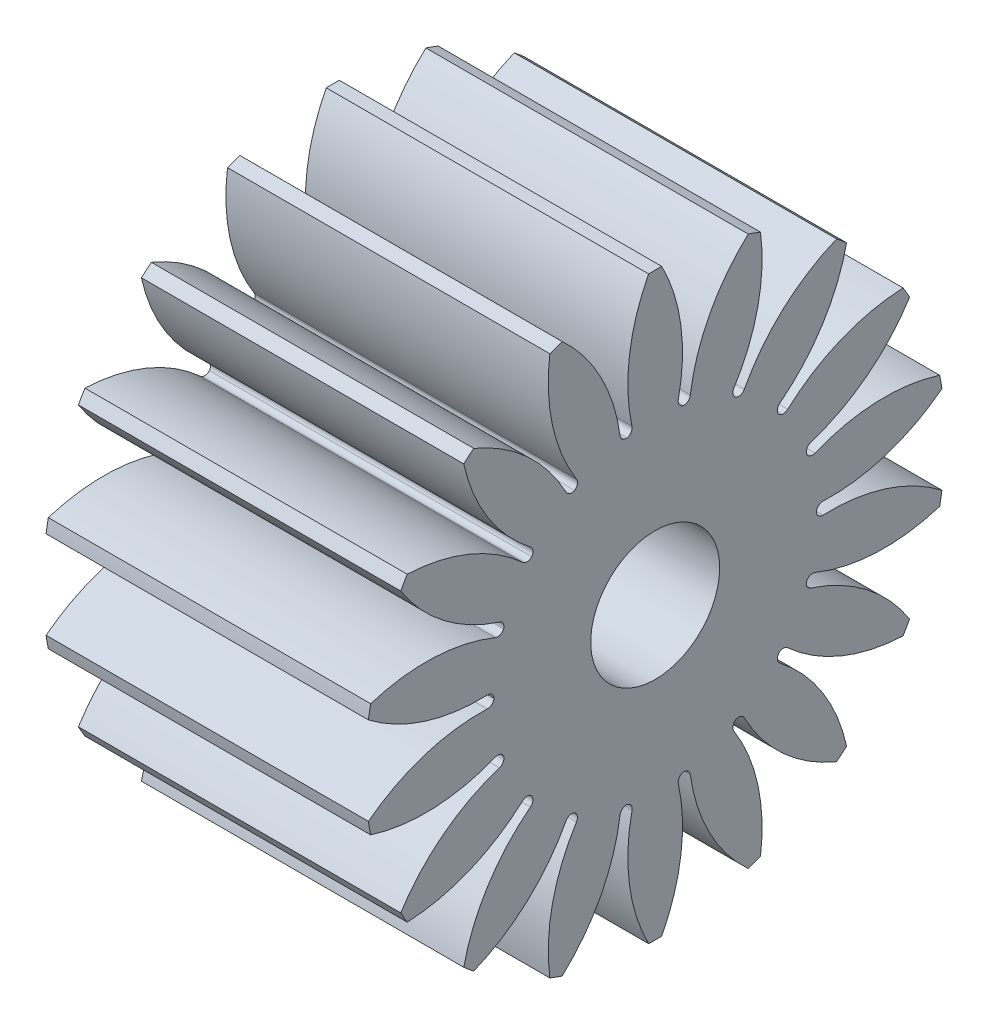
from build123d import *

# Parameters (mm, degrees)
SKETCH1_R               = 45
BOSS_EXTRUDE1_DEPTH     = 50
CUT_EXTRUDE1_DEPTH      = 81.932070281
CUT_EXTRUDE1_DEPTH_BACK = 81.932070281
SKETCH2_OUTSIDE_W       = 119.35
SKETCH2_OUTSIDE_H       = 119.35
FILLET4_R               = 1
FILLET5_R               = 1
CUT_EXTRUDE2_DEPTH      = 81.644696754
CUT_EXTRUDE2_DEPTH_BACK = 81.644696754
SKETCH3_R               = 10


with BuildPart() as part:
    # Sketch1 → Boss-Extrude1 (new body)
    with BuildSketch(Plane.YZ):
        with Locations(Location((0, 0, 0), (0, 0, 270))):
            Circle(SKETCH1_R)
    extrude(amount=BOSS_EXTRUDE1_DEPTH)

    # Sketch2 outside → Cut-Extrude1 (cut, two sides: drawn at the far end of the back side and taken through both)
    with BuildSketch(Plane.YZ.offset(50).offset(-CUT_EXTRUDE1_DEPTH_BACK)):
        Rectangle(SKETCH2_OUTSIDE_W, SKETCH2_OUTSIDE_H)
        with BuildLine():
            ThreePointArc((8.810204422, 44.129132079), (7.814167995, 44.316348886), (6.814167995, 44.481087156))
            ThreePointArc((6.814167995, 44.481087156), (2.105399573, 35.267704069), (1, 24.979991994))
            ThreePointArc((1, 24.979991994), (0, 25), (-1, 24.979991994))
            ThreePointArc((-1, 24.979991994), (-2.105399573, 35.267704069), (-6.814167995, 44.481087156))
            ThreePointArc((-6.814167995, 44.481087156), (-7.814167995, 44.316348886), (-8.810204422, 44.129132079))
            ThreePointArc((-8.810204422, 44.129132079), (-10.083836757, 33.860890329), (-7.603967821, 23.815534287))
            ThreePointArc((-7.603967821, 23.815534287), (-8.550503583, 23.49231552), (-9.483353063, 23.131494))
            ThreePointArc((-9.483353063, 23.131494), (-14.040693643, 32.420712202), (-21.616651186, 39.46796665))
            ThreePointArc((-21.616651186, 39.46796665), (-22.5, 38.97114317), (-23.371936162, 38.454552397))
            ThreePointArc((-23.371936162, 38.454552397), (-21.056813554, 28.369953482), (-15.2907849, 19.778571666))
            ThreePointArc((-15.2907849, 19.778571666), (-16.069690242, 19.151111078), (-16.822873787, 18.492996446))
            ThreePointArc((-16.822873787, 18.492996446), (-24.282472841, 25.663303964), (-33.811847216, 29.694426882))
            ThreePointArc((-33.811847216, 29.694426882), (-34.47199994, 28.925442436), (-35.114667467, 28.141786167))
            ThreePointArc((-35.114667467, 28.141786167), (-29.49002787, 19.45718155), (-21.133307653, 13.356021401))
            ThreePointArc((-21.133307653, 13.356021401), (-21.650635095, 12.5), (-22.133307653, 11.623970593))
            ThreePointArc((-22.133307653, 11.623970593), (-31.595427443, 15.810522519), (-41.928835462, 16.339300988))
            ThreePointArc((-41.928835462, 16.339300988), (-42.286167935, 15.39090645), (-42.622051639, 14.434705197))
            ThreePointArc((-42.622051639, 14.434705197), (-34.366309599, 8.197586365), (-24.426841608, 5.322537841))
            ThreePointArc((-24.426841608, 5.322537841), (-24.620193825, 4.341204442), (-24.774137963, 3.352922335))
            ThreePointArc((-24.774137963, 3.352922335), (-35.097507197, 4.050758719), (-44.988587348, 1.013414253))
            ThreePointArc((-44.988587348, 1.013414253), (-45, 0), (-44.988587348, -1.013414253))
            ThreePointArc((-44.988587348, -1.013414253), (-35.097507197, -4.050758719), (-24.774137963, -3.352922335))
            ThreePointArc((-24.774137963, -3.352922335), (-24.620193825, -4.341204442), (-24.426841608, -5.322537841))
            ThreePointArc((-24.426841608, -5.322537841), (-34.366309599, -8.197586365), (-42.622051639, -14.434705197))
            ThreePointArc((-42.622051639, -14.434705197), (-42.286167935, -15.39090645), (-41.928835462, -16.339300988))
            ThreePointArc((-41.928835462, -16.339300988), (-31.595427443, -15.810522519), (-22.133307653, -11.623970593))
            ThreePointArc((-22.133307653, -11.623970593), (-21.650635095, -12.5), (-21.133307653, -13.356021401))
            ThreePointArc((-21.133307653, -13.356021401), (-29.49002787, -19.45718155), (-35.114667467, -28.141786167))
            ThreePointArc((-35.114667467, -28.141786167), (-34.47199994, -28.925442436), (-33.811847216, -29.694426882))
            ThreePointArc((-33.811847216, -29.694426882), (-24.282472841, -25.663303964), (-16.822873787, -18.492996446))
            ThreePointArc((-16.822873787, -18.492996446), (-16.069690242, -19.151111078), (-15.2907849, -19.778571666))
            ThreePointArc((-15.2907849, -19.778571666), (-21.056813554, -28.369953482), (-23.371936162, -38.454552397))
            ThreePointArc((-23.371936162, -38.454552397), (-22.5, -38.97114317), (-21.616651186, -39.46796665))
            ThreePointArc((-21.616651186, -39.46796665), (-14.040693643, -32.420712202), (-9.483353063, -23.131494))
            ThreePointArc((-9.483353063, -23.131494), (-8.550503583, -23.49231552), (-7.603967821, -23.815534287))
            ThreePointArc((-7.603967821, -23.815534287), (-10.083836757, -33.860890329), (-8.810204423, -44.129132079))
            ThreePointArc((-8.810204423, -44.129132079), (-7.814167995, -44.316348886), (-6.814167995, -44.481087156))
            ThreePointArc((-6.814167995, -44.481087156), (-2.105399573, -35.267704069), (-1, -24.979991994))
            ThreePointArc((-1, -24.979991994), (0, -25), (1, -24.979991994))
            ThreePointArc((1, -24.979991994), (2.105399573, -35.267704069), (6.814167995, -44.481087156))
            ThreePointArc((6.814167995, -44.481087156), (7.814167995, -44.316348886), (8.810204422, -44.129132079))
            ThreePointArc((8.810204422, -44.129132079), (10.083836757, -33.860890329), (7.603967821, -23.815534287))
            ThreePointArc((7.603967821, -23.815534287), (8.550503583, -23.49231552), (9.483353063, -23.131494))
            ThreePointArc((9.483353063, -23.131494), (14.040693643, -32.420712202), (21.616651186, -39.46796665))
            ThreePointArc((21.616651186, -39.46796665), (22.5, -38.97114317), (23.371936162, -38.454552397))
            ThreePointArc((23.371936162, -38.454552397), (21.056813554, -28.369953482), (15.2907849, -19.778571666))
            ThreePointArc((15.2907849, -19.778571666), (16.069690242, -19.151111078), (16.822873787, -18.492996446))
            ThreePointArc((16.822873787, -18.492996446), (24.282472841, -25.663303964), (33.811847216, -29.694426882))
            ThreePointArc((33.811847216, -29.694426882), (34.47199994, -28.925442436), (35.114667467, -28.141786167))
            ThreePointArc((35.114667467, -28.141786167), (29.49002787, -19.45718155), (21.133307653, -13.356021401))
            ThreePointArc((21.133307653, -13.356021401), (21.650635095, -12.5), (22.133307653, -11.623970593))
            ThreePointArc((22.133307653, -11.623970593), (31.595427443, -15.810522519), (41.928835462, -16.339300988))
            ThreePointArc((41.928835462, -16.339300988), (42.286167935, -15.39090645), (42.622051639, -14.434705197))
            ThreePointArc((42.622051639, -14.434705197), (34.366309599, -8.197586365), (24.426841608, -5.322537841))
            ThreePointArc((24.426841608, -5.322537841), (24.620193825, -4.341204442), (24.774137963, -3.352922335))
            ThreePointArc((24.774137963, -3.352922335), (35.097507197, -4.050758719), (44.988587348, -1.013414253))
            ThreePointArc((44.988587348, -1.013414253), (45, 0), (44.988587348, 1.013414253))
            ThreePointArc((44.988587348, 1.013414253), (35.097507197, 4.050758719), (24.774137963, 3.352922335))
            ThreePointArc((24.774137963, 3.352922335), (24.620193825, 4.341204442), (24.426841608, 5.322537841))
            ThreePointArc((24.426841608, 5.322537841), (34.366309599, 8.197586365), (42.622051639, 14.434705197))
            ThreePointArc((42.622051639, 14.434705197), (42.286167935, 15.39090645), (41.928835462, 16.339300988))
            ThreePointArc((41.928835462, 16.339300988), (31.595427443, 15.810522519), (22.133307653, 11.623970593))
            ThreePointArc((22.133307653, 11.623970593), (21.650635095, 12.5), (21.133307653, 13.356021401))
            ThreePointArc((21.133307653, 13.356021401), (29.49002787, 19.45718155), (35.114667467, 28.141786167))
            ThreePointArc((35.114667467, 28.141786167), (34.47199994, 28.925442436), (33.811847216, 29.694426882))
            ThreePointArc((33.811847216, 29.694426882), (24.282472841, 25.663303964), (16.822873787, 18.492996446))
            ThreePointArc((16.822873787, 18.492996446), (16.069690242, 19.151111078), (15.2907849, 19.778571666))
            ThreePointArc((15.2907849, 19.778571666), (21.056813554, 28.369953482), (23.371936162, 38.454552397))
            ThreePointArc((23.371936162, 38.454552397), (22.5, 38.97114317), (21.616651186, 39.46796665))
            ThreePointArc((21.616651186, 39.46796665), (14.040693643, 32.420712202), (9.483353063, 23.131494))
            ThreePointArc((9.483353063, 23.131494), (8.550503583, 23.49231552), (7.603967821, 23.815534287))
            ThreePointArc((7.603967821, 23.815534287), (10.083836757, 33.860890329), (8.810204422, 44.129132079))
        make_face(mode=Mode.SUBTRACT)
    extrude(amount=CUT_EXTRUDE1_DEPTH + CUT_EXTRUDE1_DEPTH_BACK, mode=Mode.SUBTRACT)

    # Fillet4
    # the kernel refuses this fillet: 1 mm, written as the material it adds along each edge
    with BuildSketch(Plane(origin=(0, 9.483353063, 23.131494), x_dir=(0, -0.9330765030084109, 0.35967796642774086), z_dir=(1, 0, 0))) as fillet4_piece_1:
        with BuildLine():
            CenterArc((1.078762588, -0.999776267), FILLET4_R, 91.212022614, 92.071085144)
            ThreePointArc((0.080403843, -1.057045955), (0.045121933, -0.528148739), (0, 0))
            ThreePointArc((0, 0), (0.52880519, -0.005593324), (1.05761038, 0))
        make_face()
    extrude(amount=50)
    with BuildSketch(Plane(origin=(0, 7.603967821, 23.815534287), x_dir=(0, 0.3950547344485719, 0.9186575840811246), z_dir=(1, 0, 0))) as fillet4_piece_2:
        with BuildLine():
            CenterArc((1.078715845, -0.999826701), FILLET4_R, 91.066700156, 92.071085144)
            ThreePointArc((0.080215055, -1.054564015), (0.045684741, -0.526857779), (0, 0))
            ThreePointArc((0, 0), (0.530049745, -0.004934224), (1.06009949, 0))
        make_face()
    extrude(amount=50)

    # Fillet5
    # the kernel refuses this fillet: 1 mm, written as the material it adds along each edge
    with BuildSketch(Plane(origin=(0, -1, 24.979991994), x_dir=(0, 0.9998222141344254, 0.018855771618662743), z_dir=(1, 0, 0)), Plane(origin=(0, -9.483353063, 23.131494), x_dir=(0, 0.9330765030084159, 0.35967796642772726), z_dir=(1, 0, 0)), Plane(origin=(0, -16.822873787, 18.492996446), x_dir=(0, 0.7537879948770314, 0.6571176902041708), z_dir=(1, 0, 0)), Plane(origin=(0, -22.133307653, 11.623970593), x_dir=(0, 0.48358152983748676, 0.8752993225177523), z_dir=(1, 0, 0)), Plane(origin=(0, -24.774137963, 3.352922335), x_dir=(0, 0.1550479953962816, 0.9879069384934973), z_dir=(1, 0, 0)), Plane(origin=(0, -24.426841608, -5.322537841), x_dir=(0, -0.19218661555444733, 0.9813583977333291), z_dir=(1, 0, 0)), Plane(origin=(0, -21.133307653, -13.356021401), x_dir=(0, -0.5162406842969376, 0.8564435508990826), z_dir=(1, 0, 0)), Plane(origin=(0, -15.2907849, -19.778571666), x_dir=(0, -0.7780285076121528, 0.628228972065764), z_dir=(1, 0, 0)), Plane(origin=(0, -7.603967821, -23.815534287), x_dir=(0, -0.9459746104314817, 0.3242407075291545), z_dir=(1, 0, 0)), Plane(origin=(0, 1, -24.979991994), x_dir=(0, -0.9998222141344254, -0.018855771618666053), z_dir=(1, 0, 0)), Plane(origin=(0, 9.483353063, -23.131494), x_dir=(0, -0.9330765030084167, -0.35967796642772554), z_dir=(1, 0, 0)), Plane(origin=(0, 16.822873787, -18.492996446), x_dir=(0, -0.7537879948770301, -0.6571176902041721), z_dir=(1, 0, 0)), Plane(origin=(0, 22.133307653, -11.623970593), x_dir=(0, -0.483581529837466, -0.8752993225177635), z_dir=(1, 0, 0)), Plane(origin=(0, 24.774137963, -3.352922335), x_dir=(0, -0.1550479953962692, -0.9879069384934992), z_dir=(1, 0, 0)), Plane(origin=(0, 24.426841608, 5.322537841), x_dir=(0, 0.19218661555446737, -0.9813583977333252), z_dir=(1, 0, 0)), Plane(origin=(0, 21.133307653, 13.356021401), x_dir=(0, 0.5162406842969336, -0.8564435508990849), z_dir=(1, 0, 0)), Plane(origin=(0, 15.2907849, 19.778571666), x_dir=(0, 0.7780285076121564, -0.6282289720657595), z_dir=(1, 0, 0))) as fillet5_piece_1:
        with BuildLine():
            CenterArc((1.078762588, 0.999776267), FILLET5_R, 176.716892242, 92.071085144)
            ThreePointArc((0.080403843, 1.057045955), (0.045121933, 0.528148739), (0, 0))
            ThreePointArc((0, 0), (0.52880519, 0.005593324), (1.05761038, 0))
        make_face()
    extrude(amount=50)
    with BuildSketch(Plane(origin=(0, -15.2907849, 19.778571666), x_dir=(0, -0.6854294173424877, 0.7281390758924683), z_dir=(1, 0, 0)), Plane(origin=(0, -21.133307653, 13.356021401), x_dir=(0, -0.8931311966440857, 0.4497962489629092), z_dir=(1, 0, 0)), Plane(origin=(0, 1, 24.979991994), x_dir=(0, -0.057030620193220485, 0.9983724296876275), z_dir=(1, 0, 0)), Plane(origin=(0, -7.603967821, 23.815534287), x_dir=(0, -0.3950547344485598, 0.9186575840811296), z_dir=(1, 0, 0)), Plane(origin=(0, -24.426841608, 5.322537841), x_dir=(0, -0.9931081724177778, 0.11720135612279145), z_dir=(1, 0, 0)), Plane(origin=(0, -24.774137963, -3.352922335), x_dir=(0, -0.9733016458822474, -0.2295297499735233), z_dir=(1, 0, 0)), Plane(origin=(0, -22.133307653, -11.623970593), x_dir=(0, -0.8361005764508735, -0.5485761807247167), z_dir=(1, 0, 0)), Plane(origin=(0, -16.822873787, -18.492996446), x_dir=(0, -0.5980534379692162, -0.801456227958334), z_dir=(1, 0, 0)), Plane(origin=(0, -9.483353063, -23.131494), x_dir=(0, -0.2878722285397483, -0.9576688258659979), z_dir=(1, 0, 0)), Plane(origin=(0, -1, -24.979991994), x_dir=(0, 0.05703062019321046, -0.9983724296876278), z_dir=(1, 0, 0)), Plane(origin=(0, 7.603967821, -23.815534287), x_dir=(0, 0.3950547344485651, -0.9186575840811275), z_dir=(1, 0, 0)), Plane(origin=(0, 15.2907849, -19.778571666), x_dir=(0, 0.6854294173424931, -0.7281390758924633), z_dir=(1, 0, 0)), Plane(origin=(0, 21.133307653, -13.356021401), x_dir=(0, 0.8931311966440877, -0.44979624896290515), z_dir=(1, 0, 0)), Plane(origin=(0, 24.774137963, 3.352922335), x_dir=(0, 0.9733016458822443, 0.22952974997353692), z_dir=(1, 0, 0)), Plane(origin=(0, 22.133307653, 11.623970593), x_dir=(0, 0.836100576450868, 0.5485761807247248), z_dir=(1, 0, 0)), Plane(origin=(0, 16.822873787, 18.492996446), x_dir=(0, 0.598053437969207, 0.8014562279583408), z_dir=(1, 0, 0))) as fillet5_piece_2:
        with BuildLine():
            CenterArc((1.078715845, 0.999826701), FILLET5_R, 176.8622147, 92.071085144)
            ThreePointArc((0.080215055, 1.054564015), (0.045684741, 0.526857779), (0, 0))
            ThreePointArc((0, 0), (0.530049745, 0.004934224), (1.06009949, 0))
        make_face()
    extrude(amount=50)
    with BuildSketch(Plane(origin=(50, 24.426841608, -5.322537841), x_dir=(0, 0.9931081724177783, -0.11720135612278652), z_dir=(-1, 0, 0))) as fillet5_piece_3:
        with BuildLine():
            CenterArc((1.078715845, -0.999826701), FILLET5_R, 91.066700156, 92.071085144)
            ThreePointArc((0.080215055, -1.054564015), (0.045684741, -0.526857779), (0, 0))
            ThreePointArc((0, 0), (0.530049745, -0.004934224), (1.06009949, 0))
        make_face()
    extrude(amount=50)

    # Sketch3 → Cut-Extrude2 (cut, two sides: drawn at the far end of the back side and taken through both)
    with BuildSketch(Plane(origin=(50, 0, 0), x_dir=(0, 0, -1), z_dir=(1, 0, 0)).offset(-CUT_EXTRUDE2_DEPTH_BACK)):
        Circle(SKETCH3_R)
    extrude(amount=CUT_EXTRUDE2_DEPTH + CUT_EXTRUDE2_DEPTH_BACK, mode=Mode.SUBTRACT)


solid = part.part
